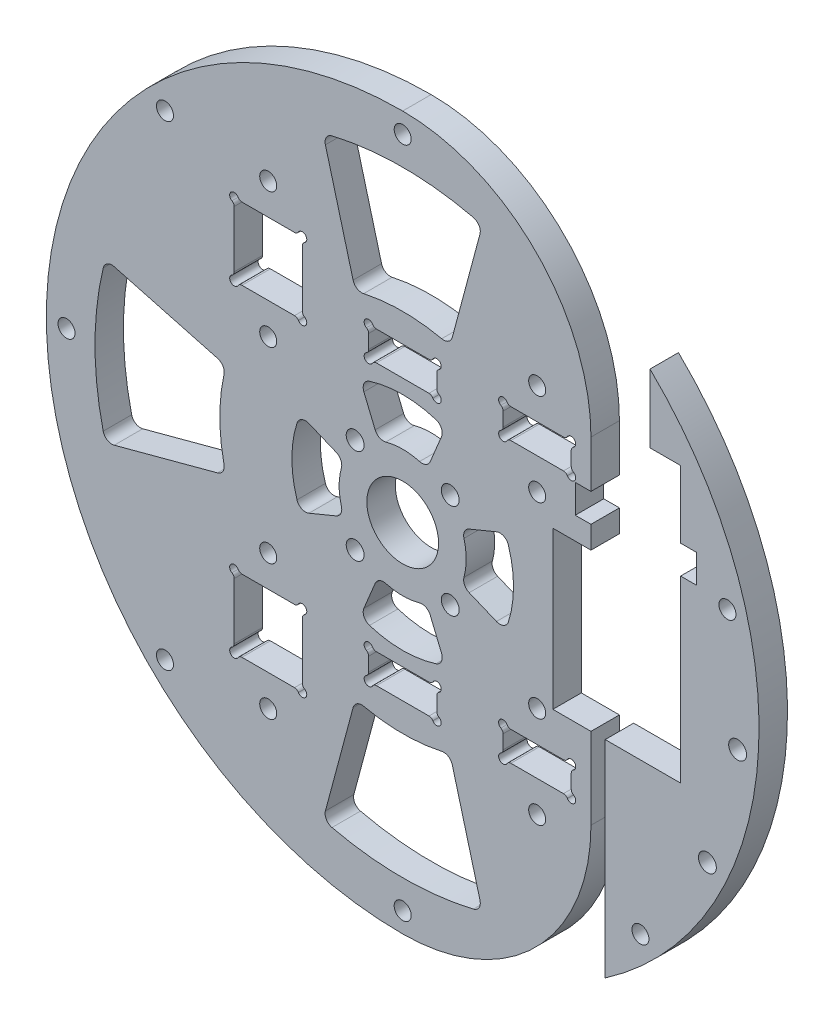
from build123d import *

# Parameters (mm, degrees)
SKETCH1_R                = 79.5
SKETCH1_R_2              = 1.9939
SKETCH1_R_3              = 1.89865
SKETCH1_R_4              = 8
BOSS_EXTRUDE1_DEPTH      = 6.35
SKETCH5_W                = 15.2
SKETCH5_H                = 16.075
CUT_EXTRUDE4_DEPTH       = 113.609158153
SKETCH6_R                = 1
CUT_EXTRUDE5_DEPTH       = 113.609158153
FILLET1_R                = 1
SKETCH10_W               = 53.523609979
SKETCH10_H               = 37.243469735
SKETCH10_W_2             = 54.285324016
SKETCH10_H_2             = 37.23416744
BOSS_EXTRUDE2_DEPTH      = 6.35
SKETCH11_W               = 15.2
SKETCH11_H               = 6.55
CUT_EXTRUDE8_DEPTH       = 113.609158153
SKETCH13_R               = 1
CUT_EXTRUDE9_DEPTH       = 113.609158153
FILLET2_R                = 1
LPATTERN3_COUNT          = 2
LPATTERN3_PITCH          = 30
FILLET2_OF_LPATTERN3_R   = 1
MIRROR3_DEPTH            = 6.35
CUT_EXTRUDE11_DEPTH      = 113.609158153
SKETCH15_W               = 6.35
SKETCH15_H               = 80
CUT_EXTRUDE12_DEPTH      = 113.609158153
CUT_EXTRUDE14_DEPTH      = 113.609158153
SKETCH17_R               = 1.89865
CUT_EXTRUDE15_DEPTH      = 113.609158153
CUT_EXTRUDE18_DEPTH      = 113.609158153
CUT_EXTRUDE19_DEPTH      = 113.609158153
FILLET4_R                = 2
CIRPATTERN1_COUNT        = 4
FILLET4_OF_CIRPATTERN1_R = 2
CUT_EXTRUDE20_DEPTH      = 113.609158153
FILLET5_R                = 2
CIRPATTERN2_COUNT        = 4
FILLET5_OF_CIRPATTERN2_R = 2


# Read off the part's stored shape, not the designer's step: Mirror3
with BuildPart() as part:
    # Sketch1 → Boss-Extrude1 (new body)
    with BuildSketch(Plane.XY):
        Circle(SKETCH1_R)
        with Locations((74.714602357, -6.536680706)):
            Circle(SKETCH1_R_2, mode=Mode.SUBTRACT)
        with Locations((72.444436972, 19.411428383)):
            Circle(SKETCH1_R_3, mode=Mode.SUBTRACT)
        Circle(SKETCH1_R_4, mode=Mode.SUBTRACT)
        with Locations((67.973084028, -31.696369631)):
            Circle(SKETCH1_R_2, mode=Mode.SUBTRACT)
        with Locations((10.606601718, -10.606601718)):
            Circle(SKETCH1_R_2, mode=Mode.SUBTRACT)
        with Locations((0, -75)):
            Circle(SKETCH1_R_3, mode=Mode.SUBTRACT)
        with Locations((-10.606601718, -10.606601718)):
            Circle(SKETCH1_R_2, mode=Mode.SUBTRACT)
        with Locations((-10.606601718, 10.606601718)):
            Circle(SKETCH1_R_2, mode=Mode.SUBTRACT)
        with Locations((10.606601718, 10.606601718)):
            Circle(SKETCH1_R_2, mode=Mode.SUBTRACT)
        with Locations((-53.033008589, -53.033008589)):
            Circle(SKETCH1_R_3, mode=Mode.SUBTRACT)
        with Locations((-75, 0)):
            Circle(SKETCH1_R_3, mode=Mode.SUBTRACT)
        with Locations((-53.033008589, 53.033008589)):
            Circle(SKETCH1_R_3, mode=Mode.SUBTRACT)
        with Locations((0, 75)):
            Circle(SKETCH1_R_3, mode=Mode.SUBTRACT)
        with Locations((53.033008589, -53.033008589)):
            Circle(SKETCH1_R_3, mode=Mode.SUBTRACT)
    extrude(amount=BOSS_EXTRUDE1_DEPTH)

    # Sketch5 → Cut-Extrude4 (cut, through all)
    with BuildSketch(Plane.XY.offset(6.35)):
        with Locations((-30, -35.9375)):
            Rectangle(SKETCH5_W, SKETCH5_H)
        with Locations((-30, 35.9375)):
            Rectangle(SKETCH5_W, SKETCH5_H)
        with Locations((30, 35.9375)):
            Rectangle(SKETCH5_W, SKETCH5_H)
        with Locations((0, -35.9375)):
            Rectangle(SKETCH5_W, SKETCH5_H)
        with Locations((30, -35.9375)):
            Rectangle(SKETCH5_W, SKETCH5_H)
        with Locations((0, 35.9375)):
            Rectangle(SKETCH5_W, SKETCH5_H)
    extrude(amount=-CUT_EXTRUDE4_DEPTH, mode=Mode.SUBTRACT)

    # Sketch6 → Cut-Extrude5 (cut, through all)
    with BuildSketch(Plane.XY.offset(6.35)):
        with Locations((-37.6, 43.975)):
            Circle(SKETCH6_R)
        with Locations((-22.4, 43.975)):
            Circle(SKETCH6_R)
        with Locations((-37.6, 27.9)):
            Circle(SKETCH6_R)
        with Locations((-22.4, 27.9)):
            Circle(SKETCH6_R)
        with Locations((-7.6, 43.975)):
            Circle(SKETCH6_R)
        with Locations((7.6, 43.975)):
            Circle(SKETCH6_R)
        with Locations((-7.6, 27.9)):
            Circle(SKETCH6_R)
        with Locations((7.6, 27.9)):
            Circle(SKETCH6_R)
        with Locations((22.4, 43.975)):
            Circle(SKETCH6_R)
        with Locations((37.6, 43.975)):
            Circle(SKETCH6_R)
        with Locations((22.4, 27.9)):
            Circle(SKETCH6_R)
        with Locations((37.6, 27.9)):
            Circle(SKETCH6_R)
        with Locations((-37.6, -27.9)):
            Circle(SKETCH6_R)
        with Locations((-22.4, -27.9)):
            Circle(SKETCH6_R)
        with Locations((-37.6, -43.975)):
            Circle(SKETCH6_R)
        with Locations((-22.4, -43.975)):
            Circle(SKETCH6_R)
        with Locations((-7.6, -27.9)):
            Circle(SKETCH6_R)
        with Locations((7.6, -27.9)):
            Circle(SKETCH6_R)
        with Locations((-7.6, -43.975)):
            Circle(SKETCH6_R)
        with Locations((7.6, -43.975)):
            Circle(SKETCH6_R)
        with Locations((22.4, -27.9)):
            Circle(SKETCH6_R)
        with Locations((37.6, -27.9)):
            Circle(SKETCH6_R)
        with Locations((22.4, -43.975)):
            Circle(SKETCH6_R)
        with Locations((37.6, -43.975)):
            Circle(SKETCH6_R)
    extrude(amount=-CUT_EXTRUDE5_DEPTH, mode=Mode.SUBTRACT)

    # Fillet1
    fillet1_edges = [part.edges().sort_by_distance(p)[0] for p in [
        (-37.6, 42.975, 3.175),
        (-36.6, 43.975, 3.175),
        (-22.4, 42.975, 3.175),
        (-23.4, 43.975, 3.175),
        (-37.6, 28.9, 3.175),
        (-36.6, 27.9, 3.175),
        (-23.4, 27.9, 3.175),
        (-22.4, 28.9, 3.175),
        (-7.6, 42.975, 3.175),
        (-6.6, 43.975, 3.175),
        (7.6, 42.975, 3.175),
        (6.6, 43.975, 3.175),
        (-7.6, 28.9, 3.175),
        (-6.6, 27.9, 3.175),
        (6.6, 27.9, 3.175),
        (7.6, 28.9, 3.175),
        (22.4, 42.975, 3.175),
        (23.4, 43.975, 3.175),
        (37.6, 42.975, 3.175),
        (36.6, 43.975, 3.175),
        (22.4, 28.9, 3.175),
        (23.4, 27.9, 3.175),
        (36.6, 27.9, 3.175),
        (37.6, 28.9, 3.175),
        (-36.6, -27.9, 3.175),
        (-37.6, -28.9, 3.175),
        (-22.4, -28.9, 3.175),
        (-23.4, -27.9, 3.175),
        (-36.6, -43.975, 3.175),
        (-37.6, -42.975, 3.175),
        (-23.4, -43.975, 3.175),
        (-22.4, -42.975, 3.175),
        (-6.6, -27.9, 3.175),
        (-7.6, -28.9, 3.175),
        (7.6, -28.9, 3.175),
        (6.6, -27.9, 3.175),
        (-6.6, -43.975, 3.175),
        (-7.6, -42.975, 3.175),
        (6.6, -43.975, 3.175),
        (7.6, -42.975, 3.175),
        (23.4, -27.9, 3.175),
        (22.4, -28.9, 3.175),
        (37.6, -28.9, 3.175),
        (36.6, -27.9, 3.175),
        (23.4, -43.975, 3.175),
        (22.4, -42.975, 3.175),
        (36.6, -43.975, 3.175),
        (37.6, -42.975, 3.175),
    ]]
    fillet(fillet1_edges, radius=FILLET1_R)

    # Sketch10 → Boss-Extrude2 (add, through all)
    with BuildSketch(Plane(origin=(0, 0, 0), x_dir=(-1, 0, 0), z_dir=(0, 0, -1))):
        with Locations((-13.786008458, 43.712822415)):
            Rectangle(SKETCH10_W, SKETCH10_H)
        with Locations((-15.177733449, -42.065637654)):
            Rectangle(SKETCH10_W_2, SKETCH10_H_2)
    extrude(amount=-BOSS_EXTRUDE2_DEPTH)

    # Sketch11 → Cut-Extrude8 (cut, through all)
    with BuildSketch(Plane(origin=(0, 0, 0), x_dir=(-1, 0, 0), z_dir=(0, 0, -1))):
        with Locations((0, 31.175)):
            Rectangle(SKETCH11_W, SKETCH11_H)
    cut_extrude8 = extrude(amount=-CUT_EXTRUDE8_DEPTH, mode=Mode.SUBTRACT)

    # Sketch13 → Cut-Extrude9 (cut, through all)
    with BuildSketch(Plane(origin=(0, 0, 0), x_dir=(-1, 0, 0), z_dir=(0, 0, -1))):
        with Locations((-7.6, 34.45)):
            Circle(SKETCH13_R)
        with Locations((-7.6, 27.9)):
            Circle(SKETCH13_R)
        with Locations((7.6, 27.9)):
            Circle(SKETCH13_R)
        with Locations((7.6, 34.45)):
            Circle(SKETCH13_R)
    cut_extrude9 = extrude(amount=-CUT_EXTRUDE9_DEPTH, mode=Mode.SUBTRACT)

    # Fillet2
    fillet2_edges = [part.edges().sort_by_distance(p)[0] for p in [
        (6.6, 34.45, 3.175),
        (7.6, 33.45, 3.175),
        (-6.6, 34.45, 3.175),
        (7.6, 28.9, 3.175),
        (-6.6, 27.9, 3.175),
        (6.6, 27.9, 3.175),
        (-7.6, 28.9, 3.175),
        (-7.6, 33.45, 3.175),
    ]]
    fillet(fillet2_edges, radius=FILLET2_R)

    # LPattern3: Cut-Extrude8, Cut-Extrude9 ×2
    with Locations(*[(i * LPATTERN3_PITCH, 0, 0) for i in range(1, LPATTERN3_COUNT)]):
        add(cut_extrude8, mode=Mode.SUBTRACT)
        add(cut_extrude9, mode=Mode.SUBTRACT)

    # Fillet2 of LPattern3
    fillet2_of_lpattern3_edges = [part.edges().sort_by_distance(p)[0] for p in [
        (36.6, 34.45, 3.175),
        (37.6, 33.45, 3.175),
        (23.4, 34.45, 3.175),
        (37.6, 28.9, 3.175),
        (23.4, 27.9, 3.175),
        (36.6, 27.9, 3.175),
        (22.4, 28.9, 3.175),
        (22.4, 33.45, 3.175),
    ]]
    fillet(fillet2_of_lpattern3_edges, radius=FILLET2_OF_LPATTERN3_R)

    # Mirror3 outline → Mirror3 (cut)
    with BuildSketch(Plane.XY):
        with BuildLine():
            Line((-5.867949192, -34.45), (5.867949192, -34.45))
            ThreePointArc((5.867949192, -34.45), (6.367949192, -34.583974596), (6.733974596, -34.95))
            ThreePointArc((6.733974596, -34.95), (8.307106781, -35.157106781), (8.1, -33.583974596))
            ThreePointArc((8.1, -33.583974596), (7.733974596, -33.217949192), (7.6, -32.717949192))
            Line((7.6, -32.717949192), (7.6, -29.632050808))
            ThreePointArc((7.6, -29.632050808), (7.733974596, -29.132050808), (8.1, -28.766025404))
            ThreePointArc((8.1, -28.766025404), (8.307106781, -27.192893219), (6.733974596, -27.4))
            ThreePointArc((6.733974596, -27.4), (6.367949192, -27.766025404), (5.867949192, -27.9))
            Line((5.867949192, -27.9), (-5.867949192, -27.9))
            ThreePointArc((-5.867949192, -27.9), (-6.367949192, -27.766025404), (-6.733974596, -27.4))
            ThreePointArc((-6.733974596, -27.4), (-8.307106781, -27.192893219), (-8.1, -28.766025404))
            ThreePointArc((-8.1, -28.766025404), (-7.733974596, -29.132050808), (-7.6, -29.632050808))
            Line((-7.6, -29.632050808), (-7.6, -32.717949192))
            ThreePointArc((-7.6, -32.717949192), (-7.733974596, -33.217949192), (-8.1, -33.583974596))
            ThreePointArc((-8.1, -33.583974596), (-8.307106781, -35.157106781), (-6.733974596, -34.95))
            ThreePointArc((-6.733974596, -34.95), (-6.367949192, -34.583974596), (-5.867949192, -34.45))
        make_face()
        with BuildLine():
            Line((24.132050808, -34.45), (35.867949192, -34.45))
            ThreePointArc((35.867949192, -34.45), (36.367949192, -34.583974596), (36.733974596, -34.95))
            ThreePointArc((36.733974596, -34.95), (38.307106781, -35.157106781), (38.1, -33.583974596))
            ThreePointArc((38.1, -33.583974596), (37.733974596, -33.217949192), (37.6, -32.717949192))
            Line((37.6, -32.717949192), (37.6, -29.632050808))
            ThreePointArc((37.6, -29.632050808), (37.733974596, -29.132050808), (38.1, -28.766025404))
            ThreePointArc((38.1, -28.766025404), (38.307106781, -27.192893219), (36.733974596, -27.4))
            ThreePointArc((36.733974596, -27.4), (36.367949192, -27.766025404), (35.867949192, -27.9))
            Line((35.867949192, -27.9), (24.132050808, -27.9))
            ThreePointArc((24.132050808, -27.9), (23.632050808, -27.766025404), (23.266025404, -27.4))
            ThreePointArc((23.266025404, -27.4), (21.692893219, -27.192893219), (21.9, -28.766025404))
            ThreePointArc((21.9, -28.766025404), (22.266025404, -29.132050808), (22.4, -29.632050808))
            Line((22.4, -29.632050808), (22.4, -32.717949192))
            ThreePointArc((22.4, -32.717949192), (22.266025404, -33.217949192), (21.9, -33.583974596))
            ThreePointArc((21.9, -33.583974596), (21.692893219, -35.157106781), (23.266025404, -34.95))
            ThreePointArc((23.266025404, -34.95), (23.632050808, -34.583974596), (24.132050808, -34.45))
        make_face()
    extrude(amount=MIRROR3_DEPTH, mode=Mode.SUBTRACT)

    # Sketch14 → Cut-Extrude11 (cut, through all)
    with BuildSketch(Plane.XY):
        Polygon((33.5, -19.35), (62, -19.35), (62, 20.65), (65.5, 20.65), (65.5, 27), (62, 27), (62, 42), (42, 42), (42, 27), (38.5, 27), (38.5, 20.65), (42, 20.65), (42, 15.65), (33.5, 15.65), align=None)
    extrude(amount=CUT_EXTRUDE11_DEPTH, mode=Mode.SUBTRACT)

    # Sketch15 → Cut-Extrude12 (cut, through all)
    with BuildSketch(Plane.XY.offset(6.35)):
        with Locations((52, 42)):
            Rectangle(SKETCH15_W, SKETCH15_H)
    extrude(amount=-CUT_EXTRUDE12_DEPTH, mode=Mode.SUBTRACT)

    # Sketch16 → Cut-Extrude14 (cut, through all)
    with BuildSketch(Plane.XY):
        with BuildLine():
            Line((42, -37.5), (42, -14.02059918))
            Line((42, -14.02059918), (45.175, -14.029540215))
            Line((45.175, -14.029540215), (45.175, -79.5))
            Line((45.175, -79.5), (0, -79.5))
            ThreePointArc((0, -79.5), (29.69848481, -67.19848481), (42, -37.5))
        make_face()
        with BuildLine():
            Line((0, 79.5), (45.175, 79.5))
            Line((45.175, 79.5), (45.175, 14.029540215))
            Line((45.175, 14.029540215), (42, 14.02059918))
            Line((42, 14.02059918), (42, 37.5))
            ThreePointArc((42, 37.5), (29.69848481, 67.19848481), (0, 79.5))
        make_face()
    extrude(amount=CUT_EXTRUDE14_DEPTH, mode=Mode.SUBTRACT)


with BuildPart() as cut_extrude14_piece_1:
    # of the separate pieces the step leaves, piece 1, a body of its own (cut_extrude14_pieces)
    add(part.part.solids().sort_by_distance((0, 79.5, 6.35))[0])

    # Sketch17 → Cut-Extrude15 (cut, through all)
    with BuildSketch(Plane.XY.offset(6.35)):
        with Locations((-30, 50.975)):
            Circle(SKETCH17_R)
        with Locations((-30, 20.9)):
            Circle(SKETCH17_R)
        with Locations((30, 20.9)):
            Circle(SKETCH17_R)
        with Locations((30, 41.45)):
            Circle(SKETCH17_R)
    cut_extrude15 = extrude(amount=-CUT_EXTRUDE15_DEPTH, mode=Mode.SUBTRACT)

    # Mirror4: Cut-Extrude15 across plane
    add(cut_extrude15.mirror(Plane.ZX), mode=Mode.SUBTRACT)

    # Sketch25 → Cut-Extrude19 (cut, through all)
    with BuildSketch(Plane.XY.offset(6.35)):
        with BuildLine():
            Line((-9.461847865, -22.842921441), (-5.424537654, -13.095992373))
            ThreePointArc((-5.424537654, -13.095992373), (0, -14.175), (5.424537654, -13.095992373))
            Line((5.424537654, -13.095992373), (9.461847865, -22.842921441))
            ThreePointArc((9.461847865, -22.842921441), (0, -24.725), (-9.461847865, -22.842921441))
        make_face()
    cut_extrude19 = extrude(amount=-CUT_EXTRUDE19_DEPTH, mode=Mode.SUBTRACT)

    # Fillet4
    fillet4_edges = [cut_extrude14_piece_1.edges().sort_by_distance(p)[0] for p in [
        (-5.424537654, -13.095992373, 3.175),
        (5.424537654, -13.095992373, 3.175),
        (9.461847865, -22.842921441, 3.175),
        (-9.461847865, -22.842921441, 3.175),
    ]]
    fillet(fillet4_edges, radius=FILLET4_R)

    # CirPattern1: Cut-Extrude19 ×4 about axis
    cirpattern1_axis = Axis((0, 0, 0), (0, 0, 1))
    for i in range(1, CIRPATTERN1_COUNT):
        add(cut_extrude19.rotate(cirpattern1_axis, i * 360 / CIRPATTERN1_COUNT), mode=Mode.SUBTRACT)

    # Fillet4 of CirPattern1
    fillet4_of_cirpattern1_edges = [cut_extrude14_piece_1.edges().sort_by_distance(p)[0] for p in [
        (13.095992373, -5.424537654, 3.175),
        (13.095992373, 5.424537654, 3.175),
        (22.842921441, 9.461847865, 3.175),
        (22.842921441, -9.461847865, 3.175),
        (5.424537654, 13.095992373, 3.175),
        (-5.424537654, 13.095992373, 3.175),
        (-9.461847865, 22.842921441, 3.175),
        (9.461847865, 22.842921441, 3.175),
        (-13.095992373, 5.424537654, 3.175),
        (-13.095992373, -5.424537654, 3.175),
        (-22.842921441, -9.461847865, 3.175),
        (-22.842921441, 9.461847865, 3.175),
    ]]
    fillet(fillet4_of_cirpattern1_edges, radius=FILLET4_OF_CIRPATTERN1_R)

    # Sketch26 → Cut-Extrude20 (cut, through all)
    with BuildSketch(Plane.XY.offset(6.35)):
        with BuildLine():
            Line((-17.767927446, -66.310807975), (-10.55981704, -39.409773713))
            ThreePointArc((-10.55981704, -39.409773713), (0, -40.8), (10.55981704, -39.409773713))
            Line((10.55981704, -39.409773713), (17.767927446, -66.310807975))
            ThreePointArc((17.767927446, -66.310807975), (0, -68.65), (-17.767927446, -66.310807975))
        make_face()
    cut_extrude20 = extrude(amount=-CUT_EXTRUDE20_DEPTH, mode=Mode.SUBTRACT)

    # Fillet5
    fillet5_edges = [cut_extrude14_piece_1.edges().sort_by_distance(p)[0] for p in [
        (-10.55981704, -39.409773713, 3.175),
        (10.55981704, -39.409773713, 3.175),
        (17.767927446, -66.310807975, 3.175),
        (-17.767927446, -66.310807975, 3.175),
    ]]
    fillet(fillet5_edges, radius=FILLET5_R)

    # CirPattern2: Cut-Extrude20 ×4 about axis, 1 skipped
    cirpattern2_axis = Axis((0, 0, 0), (0, 0, -1))
    add([cut_extrude20.rotate(cirpattern2_axis, i * 360 / CIRPATTERN2_COUNT) for i in range(1, CIRPATTERN2_COUNT) if i not in (3,)], mode=Mode.SUBTRACT)

    # Fillet5 of CirPattern2
    fillet5_of_cirpattern2_edges = [cut_extrude14_piece_1.edges().sort_by_distance(p)[0] for p in [
        (-39.409773713, 10.55981704, 3.175),
        (-39.409773713, -10.55981704, 3.175),
        (-66.310807975, -17.767927446, 3.175),
        (-66.310807975, 17.767927446, 3.175),
        (10.55981704, 39.409773713, 3.175),
        (-10.55981704, 39.409773713, 3.175),
        (-17.767927446, 66.310807975, 3.175),
        (17.767927446, 66.310807975, 3.175),
    ]]
    fillet(fillet5_of_cirpattern2_edges, radius=FILLET5_OF_CIRPATTERN2_R)


with BuildPart() as cut_extrude14_piece_2:
    # of the separate pieces the step leaves, piece 2, a body of its own (cut_extrude14_pieces)
    add(part.part.solids().sort_by_distance((45.175, -65.41765339, 6.35))[0])


with BuildPart() as cut_extrude14_piece_3:
    # of the separate pieces the step leaves, piece 3, a body of its own (cut_extrude14_pieces)
    add(part.part.solids().sort_by_distance((48.825, 62.740492308, 6.35))[0])

    # Sketch24 → Cut-Extrude18 (cut, through all)
    with BuildSketch(Plane.XY.offset(6.35)):
        with BuildLine():
            Line((45.175, 65.41765339), (45.175, 42))
            Line((45.175, 42), (48.825, 42))
            Line((48.825, 42), (48.825, 62.740492308))
            ThreePointArc((48.825, 62.740492308), (47.019057816, 64.10505598), (45.175, 65.41765339))
        make_face()
    extrude(amount=-CUT_EXTRUDE18_DEPTH, mode=Mode.SUBTRACT)


solid = Compound([cut_extrude14_piece_1.part, cut_extrude14_piece_2.part])
